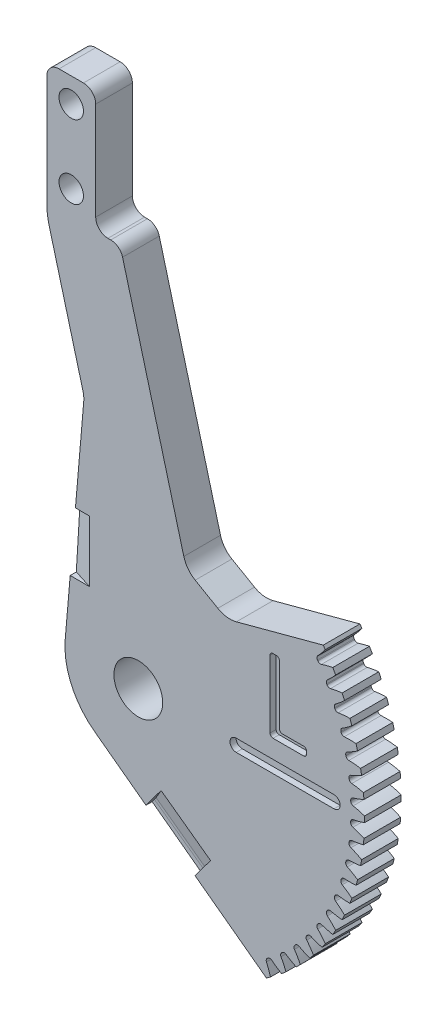
from build123d import *

# Parameters (mm, degrees)
SKETCH2_R                   = 60.325
BOSS_EXTRUDE2_DEPTH         = 4.7625
BOSS_EXTRUDE3_DEPTH         = 9.525
SKETCH4_W                   = 19.05
SKETCH4_H                   = 31.75
BOSS_EXTRUDE4_DEPTH         = 9.525
BOSS_EXTRUDE5_DEPTH         = 9.525
F_1_2_0_5_DIAMETER_HOLE1_D  = 12.6746
CUT_EXTRUDE1_DEPTH          = 143.813025258
CUT_EXTRUDE2_DEPTH          = 143.813025258
CUT_EXTRUDE3_DEPTH          = 12.7
SKETCH15_W                  = 6.35
SKETCH15_H                  = 31.75
CUT_EXTRUDE6_DEPTH          = 143.149739587
F_1_4_0_25_DIAMETER_HOLE1_D = 6.35
FILLET1_R                   = 6.35
FILLET3_R                   = 3.175
CUT_EXTRUDE4_DEPTH          = 1.5875
CUT_EXTRUDE5_DEPTH          = 1.5875
FILLET2_R                   = 0.79375
SKETCH16_W                  = 5.040493422
SKETCH16_H                  = 15.875
CUT_EXTRUDE7_DEPTH          = 1.6002
CHAMFER1_SIZE               = 1.5875
CHAMFER1_SIZE_2             = 5.08
FILLET5_R                   = 3.175


with BuildPart() as part:
    # Sketch2 → Boss-Extrude2 (new, symmetric)
    with BuildSketch(Plane.XY):
        with Locations(Location((0, 0, 0), (0, 0, 180))):
            Circle(SKETCH2_R)
    extrude(amount=BOSS_EXTRUDE2_DEPTH, both=True)

    # Sketch3 → Boss-Extrude3 (add)
    with BuildSketch(Plane.XY.offset(4.7625)):
        with BuildLine():
            Line((-14.074444457, 58.660170799), (-23.119106797, 92.415310188))
            Line((-23.119106797, 92.415310188), (-4.718219806, 97.345812997))
            Line((-4.718219806, 97.345812997), (5.263113853, 60.094968654))
            ThreePointArc((5.263113853, 60.094968654), (-4.463692191, 60.159629961), (-14.074444457, 58.660170799))
        make_face()
    extrude(amount=-BOSS_EXTRUDE3_DEPTH)



with BuildPart() as body_2:
    # Sketch4 → Boss-Extrude4 (new body)
    with BuildSketch(Plane.XY.offset(4.7625)):
        with Locations((-14.243219806, 113.220812997)):
            Rectangle(SKETCH4_W, SKETCH4_H)
    extrude(amount=-BOSS_EXTRUDE4_DEPTH)


with BuildPart() as part_1:
    add(part.part)

    add(body_2.part)  # Boss-Extrude5 merges body 2
    # Sketch5 → Boss-Extrude5 (add)
    with BuildSketch(Plane.XY.offset(4.7625)):
        with BuildLine():
            Line((-23.768219806, 97.345812997), (-4.718219806, 97.345812997))
            Line((-4.718219806, 97.345812997), (-23.119106797, 92.415310188))
            ThreePointArc((-23.119106797, 92.415310188), (-23.605244415, 94.859289036), (-23.768219806, 97.345812997))
        make_face()
    extrude(amount=-BOSS_EXTRUDE5_DEPTH)

    # 1/2 (0.5) Diameter Hole1 (through all)
    with Locations(Plane.XY.offset(4.7625)):
        with Locations((0, 0)):
            Hole(F_1_2_0_5_DIAMETER_HOLE1_D / 2)

    # Sketch8 → Cut-Extrude1 (cut, through all)
    with BuildSketch(Plane.XY.offset(4.7625)):
        with BuildLine():
            Line((22.918835565, 27.09572042), (49.652983315, 34.25911372))
            ThreePointArc((49.652983315, 34.25911372), (30.344971282, 52.137206896), (5.263113853, 60.094968654))
            Line((5.263113853, 60.094968654), (12.492235056, 33.11552103))
            Line((12.492235056, 33.11552103), (22.918835565, 27.09572042))
        make_face()
    extrude(amount=-CUT_EXTRUDE1_DEPTH, mode=Mode.SUBTRACT)

    # Sketch9 → Cut-Extrude2 (cut, through all)
    with BuildSketch(Plane.XY.offset(4.7625)):
        with BuildLine():
            Line((-14.074444457, 58.660170799), (-18.979910276, 1.632637712))
            ThreePointArc((-18.979910276, 1.632637712), (-17.369610236, -7.822987937), (-11.355820175, -15.29535381))
            Line((-11.355820175, -15.29535381), (34.600998523, -49.415347072))
            ThreePointArc((34.600998523, -49.415347072), (-55.003765746, -24.772795134), (-14.074444457, 58.660170799))
        make_face()
    extrude(amount=-CUT_EXTRUDE2_DEPTH, mode=Mode.SUBTRACT)

    # Sketch10 → Cut-Extrude3 (cut)
    with BuildSketch(Plane.XY.offset(4.7625)):
        with BuildLine():
            Line((25.576818402, -48.910388202), (25.394784128, -49.005149247))
            ThreePointArc((25.394784128, -49.005149247), (25.037565742, -49.381038951), (24.988673966, -49.897282731))
            ThreePointArc((24.988673966, -49.897282731), (25.299382599, -51.394607832), (25.508468358, -52.909469363))
            ThreePointArc((25.508468358, -52.909469363), (24.823540148, -53.234253641), (24.13447759, -53.55017178))
            ThreePointArc((24.13447759, -53.55017178), (23.108424067, -52.416268574), (22.161126153, -51.215789929))
            ThreePointArc((22.161126153, -51.215789929), (21.734233447, -50.921408097), (21.216669675, -50.953436013))
            Line((21.216669675, -50.953436013), (21.027069126, -51.031971131))
            ThreePointArc((21.027069126, -51.031971131), (20.638449117, -51.375296828), (20.544749779, -51.885314945))
            ThreePointArc((20.544749779, -51.885314945), (20.723775591, -53.404022314), (20.800036834, -54.931342364))
            ThreePointArc((20.800036834, -54.931342364), (20.089408168, -55.195195313), (19.375433621, -55.449855529))
            ThreePointArc((19.375433621, -55.449855529), (18.452110718, -54.23084071), (17.613046167, -52.952367796))
            ThreePointArc((17.613046167, -52.952367796), (17.213434983, -52.621900026), (16.695049281, -52.60869741))
            Line((16.695049281, -52.60869741), (16.499325433, -52.670408903))
            ThreePointArc((16.499325433, -52.670408903), (16.082261434, -52.978557676), (15.944467642, -53.478468584))
            ThreePointArc((15.944467642, -53.478468584), (15.990448138, -55.006999941), (15.93330447, -56.535154683))
            Line((15.93330447, -56.535154683), (15.202383662, -56.736068222))
            Line((15.202383662, -56.736068222), (16.435009364, -61.33628997))
            ThreePointArc((16.435009364, -61.33628997), (61.336289969, -16.435009364), (44.901280605, 44.901280605))
            Line((44.901280605, 44.901280605), (41.533684559, 41.53368456))
            Line((41.533684559, 41.53368456), (42.066223778, 40.994227926))
            ThreePointArc((42.066223778, 40.994227926), (41.351634275, 39.642235265), (40.54754832, 38.341478527))
            ThreePointArc((40.54754832, 38.341478527), (40.41692579, 37.839646085), (40.624039421, 37.36424942))
            Line((40.624039421, 37.36424942), (40.762685499, 37.212943776))
            ThreePointArc((40.762685499, 37.212943776), (41.218221994, 36.965184725), (41.729529316, 37.051572618))
            ThreePointArc((41.729529316, 37.051572618), (43.09541699, 37.739230364), (44.50454549, 38.333266713))
            ThreePointArc((44.50454549, 38.333266713), (44.995535477, 37.755737224), (45.479031479, 37.171919535))
            ThreePointArc((45.479031479, 37.171919535), (44.64932728, 35.887352193), (43.734932695, 34.661625937))
            ThreePointArc((43.734932695, 34.661625937), (43.561069644, 34.173087622), (43.725961596, 33.681448842))
            Line((43.725961596, 33.681448842), (43.850892929, 33.518635159))
            ThreePointArc((43.850892929, 33.518635159), (44.283102346, 33.232116285), (44.79999319, 33.273612076))
            ThreePointArc((44.79999319, 33.273612076), (46.220616571, 33.839608122), (47.67615659, 34.308570342))
            ThreePointArc((47.67615659, 34.308570342), (48.1149432, 33.69044593), (48.54571629, 33.066710389))
            ThreePointArc((48.54571629, 33.066710389), (47.607211946, 31.8593447), (46.589467827, 30.717977442))
            ThreePointArc((46.589467827, 30.717977442), (46.373687457, 30.246451326), (46.495102803, 29.7423121))
            Line((46.495102803, 29.7423121), (46.605368586, 29.569229491))
            ThreePointArc((46.605368586, 29.569229491), (47.01096155, 29.246131375), (47.529502065, 29.242419256))
            ThreePointArc((47.529502065, 29.242419256), (48.99404935, 29.68244603), (50.484923351, 30.022765035))
            ThreePointArc((50.484923351, 30.022765035), (50.868167154, 29.36875), (51.242938888, 28.709843613))
            ThreePointArc((51.242938888, 28.709843613), (50.202776982, 27.588868358), (49.089428975, 26.540546591))
            ThreePointArc((49.089428975, 26.540546591), (48.833373506, 26.089621273), (48.910388201, 25.576818404))
            Line((48.910388201, 25.576818404), (49.005149246, 25.39478413))
            ThreePointArc((49.005149246, 25.39478413), (49.381038951, 25.037565743), (49.89728273, 24.988673967))
            ThreePointArc((49.89728273, 24.988673967), (51.394607831, 25.2993826), (52.909469362, 25.508468358))
            ThreePointArc((52.909469362, 25.508468358), (53.234253641, 24.823540148), (53.55017178, 24.13447759))
            ThreePointArc((53.55017178, 24.13447759), (52.416268573, 23.108424067), (51.215789929, 22.161126154))
            ThreePointArc((51.215789929, 22.161126154), (50.921408098, 21.734233447), (50.953436013, 21.216669675))
            Line((50.953436013, 21.216669675), (51.031971132, 21.027069126))
            ThreePointArc((51.031971132, 21.027069126), (51.375296828, 20.638449117), (51.885314945, 20.544749779))
            ThreePointArc((51.885314945, 20.544749779), (53.404022314, 20.723775591), (54.931342364, 20.800036834))
            ThreePointArc((54.931342364, 20.800036834), (55.195195313, 20.089408168), (55.449855529, 19.375433621))
            ThreePointArc((55.449855529, 19.375433621), (54.23084071, 18.452110718), (52.952367796, 17.613046167))
            ThreePointArc((52.952367796, 17.613046167), (52.621900025, 17.213434983), (52.60869741, 16.695049281))
            Line((52.60869741, 16.695049281), (52.670408902, 16.499325433))
            ThreePointArc((52.670408902, 16.499325433), (52.978557675, 16.082261434), (53.478468584, 15.944467642))
            ThreePointArc((53.478468584, 15.944467642), (55.00699994, 15.990448138), (56.535154682, 15.93330447))
            ThreePointArc((56.535154682, 15.93330447), (56.736068222, 15.202383662), (56.927532397, 14.468930904))
            ThreePointArc((56.927532397, 14.468930904), (55.632683403, 13.655365665), (54.28594617, 12.930920264))
            ThreePointArc((54.28594617, 12.930920264), (53.921907519, 12.561631885), (53.863574853, 12.04636948))
            Line((53.863574853, 12.04636948), (53.907993057, 11.846011911))
            ThreePointArc((53.907993057, 11.846011911), (54.178619708, 11.403678031), (54.664618784, 11.222838479))
            ThreePointArc((54.664618784, 11.222838479), (56.191341082, 11.135423719), (57.708700334, 10.945310039))
            ThreePointArc((57.708700334, 10.945310039), (57.845145391, 10.199659835), (57.971956367, 9.452310883))
            ThreePointArc((57.971956367, 9.452310883), (56.611127784, 8.754695032), (55.206375716, 8.150382249))
            ThreePointArc((55.206375716, 8.150382249), (54.81153674, 7.814227183), (54.708517969, 7.306009534))
            Line((54.708517969, 7.306009534), (54.735304836, 7.102543083))
            ThreePointArc((54.735304836, 7.102543083), (54.966349733, 6.638305751), (55.434738231, 6.415796738))
            ThreePointArc((55.434738231, 6.415796738), (56.94803219, 6.195652002), (58.443047933, 5.874015189))
            ThreePointArc((58.443047933, 5.874015189), (58.513986078, 5.11931044), (58.575178747, 4.363753072))
            ThreePointArc((58.575178747, 4.363753072), (57.158727299, 3.787395886), (55.706651408, 3.307814905))
            ThreePointArc((55.706651408, 3.307814905), (55.284017068, 3.007351495), (55.137096229, 2.510046445))
            Line((55.137096229, 2.510046445), (55.146047893, 2.305019615))
            ThreePointArc((55.146047893, 2.305019615), (55.335752646, 1.822411956), (55.782965846, 1.55992691))
            ThreePointArc((55.782965846, 1.55992691), (57.271314386, 1.208727632), (58.732608647, 0.758015537))
            ThreePointArc((58.732608647, 0.758015537), (58.737499999, 0), (58.732608647, -0.758015537))
            ThreePointArc((58.732608647, -0.758015537), (57.271314386, -1.208727632), (55.782965846, -1.55992691))
            ThreePointArc((55.782965846, -1.55992691), (55.335752646, -1.822411956), (55.146047894, -2.305019615))
            Line((55.146047894, -2.305019615), (55.137096229, -2.510046445))
            ThreePointArc((55.137096229, -2.510046445), (55.284017068, -3.007351494), (55.706651406, -3.307814905))
            ThreePointArc((55.706651406, -3.307814905), (57.158727298, -3.787395885), (58.575178747, -4.363753072))
            ThreePointArc((58.575178747, -4.363753072), (58.513986078, -5.119310439), (58.443047933, -5.874015188))
            ThreePointArc((58.443047933, -5.874015188), (56.94803219, -6.195652001), (55.434738231, -6.415796737))
            ThreePointArc((55.434738231, -6.415796737), (54.966349733, -6.63830575), (54.735304836, -7.102543082))
            Line((54.735304836, -7.102543082), (54.708517969, -7.306009535))
            ThreePointArc((54.708517969, -7.306009535), (54.811536739, -7.814227184), (55.206375714, -8.15038225))
            ThreePointArc((55.206375714, -8.15038225), (56.611127783, -8.754695033), (57.971956368, -9.452310884))
            ThreePointArc((57.971956368, -9.452310884), (57.845145392, -10.199659836), (57.708700335, -10.945310039))
            ThreePointArc((57.708700335, -10.945310039), (56.191341082, -11.135423719), (54.664618786, -11.222838479))
            ThreePointArc((54.664618786, -11.222838479), (54.178619709, -11.40367803), (53.907993058, -11.84601191))
            Line((53.907993058, -11.84601191), (53.863574854, -12.046369481))
            ThreePointArc((53.863574854, -12.046369481), (53.921907519, -12.561631885), (54.285946169, -12.930920264))
            ThreePointArc((54.285946169, -12.930920264), (55.632683402, -13.655365665), (56.927532396, -14.468930903))
            ThreePointArc((56.927532396, -14.468930903), (56.736068221, -15.202383662), (56.535154681, -15.93330447))
            ThreePointArc((56.535154681, -15.93330447), (55.00699994, -15.990448138), (53.478468584, -15.944467643))
            ThreePointArc((53.478468584, -15.944467643), (52.978557675, -16.082261434), (52.670408902, -16.499325433))
            Line((52.670408902, -16.499325433), (52.608697409, -16.695049282))
            ThreePointArc((52.608697409, -16.695049282), (52.621900025, -17.213434984), (52.952367795, -17.613046168))
            ThreePointArc((52.952367795, -17.613046168), (54.230840709, -18.452110719), (55.449855529, -19.375433622))
            ThreePointArc((55.449855529, -19.375433622), (55.195195313, -20.089408169), (54.931342364, -20.800036835))
            ThreePointArc((54.931342364, -20.800036835), (53.404022313, -20.723775592), (51.885314944, -20.544749781))
            ThreePointArc((51.885314944, -20.544749781), (51.375296827, -20.638449119), (51.03197113, -21.027069128))
            Line((51.03197113, -21.027069128), (50.953436012, -21.216669677))
            ThreePointArc((50.953436012, -21.216669677), (50.921408096, -21.734233449), (51.215789928, -22.161126155))
            ThreePointArc((51.215789928, -22.161126155), (52.416268573, -23.108424069), (53.550171779, -24.134477591))
            ThreePointArc((53.550171779, -24.134477591), (53.234253641, -24.823540149), (52.909469363, -25.508468358))
            ThreePointArc((52.909469363, -25.508468358), (51.394607832, -25.299382599), (49.897282731, -24.988673966))
            ThreePointArc((49.897282731, -24.988673966), (49.381038951, -25.037565742), (49.005149246, -25.394784128))
            Line((49.005149246, -25.394784128), (48.9103882, -25.576818404))
            ThreePointArc((48.9103882, -25.576818404), (48.833373505, -26.089621273), (49.089428974, -26.540546591))
            ThreePointArc((49.089428974, -26.540546591), (50.202776982, -27.588868358), (51.242938888, -28.709843613))
            ThreePointArc((51.242938888, -28.709843613), (50.868167154, -29.36875), (50.484923351, -30.022765036))
            ThreePointArc((50.484923351, -30.022765036), (48.994049349, -29.68244603), (47.529502064, -29.242419255))
            ThreePointArc((47.529502064, -29.242419255), (47.010961549, -29.246131374), (46.605368585, -29.56922949))
            Line((46.605368585, -29.56922949), (46.495102802, -29.742312099))
            ThreePointArc((46.495102802, -29.742312099), (46.373687456, -30.246451326), (46.589467826, -30.717977441))
            ThreePointArc((46.589467826, -30.717977441), (47.607211946, -31.8593447), (48.545716291, -33.06671039))
            ThreePointArc((48.545716291, -33.06671039), (48.114943201, -33.69044593), (47.67615659, -34.308570342))
            ThreePointArc((47.67615659, -34.308570342), (46.220616571, -33.839608121), (44.79999319, -33.273612075))
            ThreePointArc((44.79999319, -33.273612075), (44.283102346, -33.232116284), (43.850892929, -33.518635159))
            Line((43.850892929, -33.518635159), (43.725961596, -33.681448842))
            ThreePointArc((43.725961596, -33.681448842), (43.561069644, -34.173087621), (43.734932695, -34.661625936))
            ThreePointArc((43.734932695, -34.661625936), (44.649327281, -35.887352193), (45.47903148, -37.171919534))
            ThreePointArc((45.47903148, -37.171919534), (44.995535477, -37.755737224), (44.50454549, -38.333266713))
            ThreePointArc((44.50454549, -38.333266713), (43.095416991, -37.739230364), (41.729529317, -37.051572618))
            ThreePointArc((41.729529317, -37.051572618), (41.218221995, -36.965184725), (40.7626855, -37.212943776))
            Line((40.7626855, -37.212943776), (40.624039422, -37.36424942))
            ThreePointArc((40.624039422, -37.36424942), (40.41692579, -37.839646085), (40.54754832, -38.341478528))
            ThreePointArc((40.54754832, -38.341478528), (41.351634276, -39.642235265), (42.066223779, -40.994227926))
            ThreePointArc((42.066223779, -40.994227926), (41.53368456, -41.53368456), (40.994227926, -42.066223779))
            ThreePointArc((40.994227926, -42.066223779), (39.642235265, -41.351634276), (38.341478528, -40.547548321))
            ThreePointArc((38.341478528, -40.547548321), (37.839646085, -40.416925791), (37.36424942, -40.624039422))
            Line((37.36424942, -40.624039422), (37.212943775, -40.762685501))
            ThreePointArc((37.212943775, -40.762685501), (36.965184725, -41.218221996), (37.051572617, -41.729529318))
            ThreePointArc((37.051572617, -41.729529318), (37.739230364, -43.095416991), (38.333266714, -44.504545491))
            ThreePointArc((38.333266714, -44.504545491), (37.755737224, -44.995535478), (37.171919534, -45.479031481))
            ThreePointArc((37.171919534, -45.479031481), (35.887352191, -44.649327282), (34.661625934, -43.734932696))
            ThreePointArc((34.661625934, -43.734932696), (34.17308762, -43.561069645), (33.68144884, -43.725961597))
            Line((33.68144884, -43.725961597), (33.518635159, -43.850892929))
            ThreePointArc((33.518635159, -43.850892929), (33.232116284, -44.283102346), (33.273612075, -44.79999319))
            ThreePointArc((33.273612075, -44.79999319), (33.839608121, -46.220616571), (34.308570342, -47.67615659))
            ThreePointArc((34.308570342, -47.67615659), (33.69044593, -48.114943201), (33.066710389, -48.545716291))
            ThreePointArc((33.066710389, -48.545716291), (31.8593447, -47.607211947), (30.717977441, -46.589467827))
            ThreePointArc((30.717977441, -46.589467827), (30.246451326, -46.373687458), (29.7423121, -46.495102803))
            Line((29.7423121, -46.495102803), (29.569229488, -46.605368588))
            ThreePointArc((29.569229488, -46.605368588), (29.246131371, -47.010961552), (29.242419253, -47.529502067))
            ThreePointArc((29.242419253, -47.529502067), (29.682446028, -48.994049352), (30.022765036, -50.484923353))
            ThreePointArc((30.022765036, -50.484923353), (29.36875, -50.868167156), (28.709843612, -51.24293889))
            ThreePointArc((28.709843612, -51.24293889), (27.588868356, -50.202776984), (26.540546589, -49.089428976))
            ThreePointArc((26.540546589, -49.089428976), (26.089621271, -48.833373507), (25.576818402, -48.910388202))
        make_face()
    extrude(amount=-CUT_EXTRUDE3_DEPTH, mode=Mode.SUBTRACT)

    # Sketch15 → Cut-Extrude6 (cut, through all)
    with BuildSketch(Plane.XY.offset(4.7625)):
        with Locations((-7.893219806, 113.220812997)):
            Rectangle(SKETCH15_W, SKETCH15_H)
    extrude(amount=-CUT_EXTRUDE6_DEPTH, mode=Mode.SUBTRACT)

    # 1/4 (0.25) Diameter Hole1 (through all)
    with Locations(Plane.XY.offset(4.7625)):
        with Locations((-17.418219806, 122.745812997), (-17.418219806, 103.695812997)):
            Hole(F_1_4_0_25_DIAMETER_HOLE1_D / 2)

    # Fillet1
    fillet1_edges = [part_1.edges().sort_by_distance(p)[0] for p in [
        (22.918835565, 27.09572042, 0),
        (12.492235056, 33.11552103, 0),
        (-14.074444457, 58.660170799, 0),
    ]]
    fillet(fillet1_edges, radius=FILLET1_R)

    # Fillet3
    fillet3_edges = [part_1.edges().sort_by_distance(p)[0] for p in [
        (-23.768219806, 129.095812997, 0),
        (-11.068219806, 97.345812997, 0),
        (-11.068219806, 129.095812997, 0),
        (-4.718219806, 97.345812997, 0),
    ]]
    fillet(fillet3_edges, radius=FILLET3_R)

    # Sketch13 → Cut-Extrude4 (cut)
    with BuildSketch(Plane.XY.offset(4.7625)):
        with BuildLine():
            Line((25.4, 1.6002), (50.8, 1.6002))
            ThreePointArc((50.8, 1.6002), (52.4002, 0), (50.8, -1.6002))
            Line((50.8, -1.6002), (25.4, -1.6002))
            ThreePointArc((25.4, -1.6002), (23.7998, 0), (25.4, 1.6002))
        make_face()
    extrude(amount=-CUT_EXTRUDE4_DEPTH, mode=Mode.SUBTRACT)

    # Sketch14 → Cut-Extrude5 (cut)
    with BuildSketch(Plane.XY.offset(4.7625)):
        Polygon((34.192307692, 25.4), (36.634615385, 25.4), (36.634615385, 8.548076923), (43.717307692, 8.548076923), (43.717307692, 6.35), (34.192307692, 6.35), align=None)
    extrude(amount=-CUT_EXTRUDE5_DEPTH, mode=Mode.SUBTRACT)

    # Fillet2
    fillet2_edges = [part_1.edges().sort_by_distance(p)[0] for p in [
        (34.192307692, 6.35, 3.96875),
        (34.192307692, 25.4, 3.96875),
        (36.634615385, 25.4, 3.96875),
        (36.634615385, 8.548076923, 3.96875),
        (43.717307692, 8.548076923, 3.96875),
        (43.717307692, 6.35, 3.96875),
    ]]
    fillet(fillet2_edges, radius=FILLET2_R)

    # Sketch16 → Cut-Extrude7 (cut)
    with BuildSketch(Plane.XY.offset(4.7625)):
        with Locations((-15.170246811, 24.559999902)):
            Rectangle(SKETCH16_W, SKETCH16_H)
        Polygon((5.907458188, -19.928279645), (18.750602973, -29.259370525), (14.735928853, -34.666805669), (1.990479941, -25.204126499), align=None)
    extrude(amount=-CUT_EXTRUDE7_DEPTH, mode=Mode.SUBTRACT)

    # Chamfer1
    # the kernel refuses this chamfer: 5.08, 1.5875 mm, written as the material it adds along each edge
    with BuildSketch(Plane(origin=(-12.6500001, 45.683246375, 3.1623), x_dir=(0.11687399660721777, 0, 0.9931467509472385), z_dir=(0, -1, 0))) as chamfer1_piece_1_section:
        Polygon((CHAMFER1_SIZE * 0.993146750947, CHAMFER1_SIZE * 0.116873996607), (-CHAMFER1_SIZE_2 * 0.116873996607, CHAMFER1_SIZE_2 * 0.993146750947), (0, 0), align=None)
    chamfer1_piece_1 = extrude(amount=42.246492946, mode=Mode.PRIVATE)
    chamfer1_piece_1 = split(chamfer1_piece_1, bisect_by=Plane(origin=(-15.763924615, 39.019449791, 3.721509264), z_dir=(0.9963207494210937, -0.08570276700894902, 0)), keep=Keep.TOP, mode=Mode.PRIVATE)
    add(chamfer1_piece_1)
    with BuildSketch(Plane(origin=(-4.760034792, -12.177892327, 3.1623), x_dir=(0.06869681158220377, 0.09455304945575883, 0.9931467509472385), z_dir=(0.8090169943749441, -0.5877852522924778, 0))) as chamfer1_piece_2:
        Polygon((CHAMFER1_SIZE * 0.993146750947, CHAMFER1_SIZE * 0.116873996607), (-CHAMFER1_SIZE_2 * 0.116873996607, CHAMFER1_SIZE_2 * 0.993146750947), (0, 0), align=None)
    extrude(amount=42.246492946)

    # Fillet5
    fillet5_edges = [part_1.edges().sort_by_distance(p)[0] for p in [
        (9.30065048, -28.672803476, 3.1623),
    ]]
    fillet(fillet5_edges, radius=FILLET5_R)


solid = part_1.part
